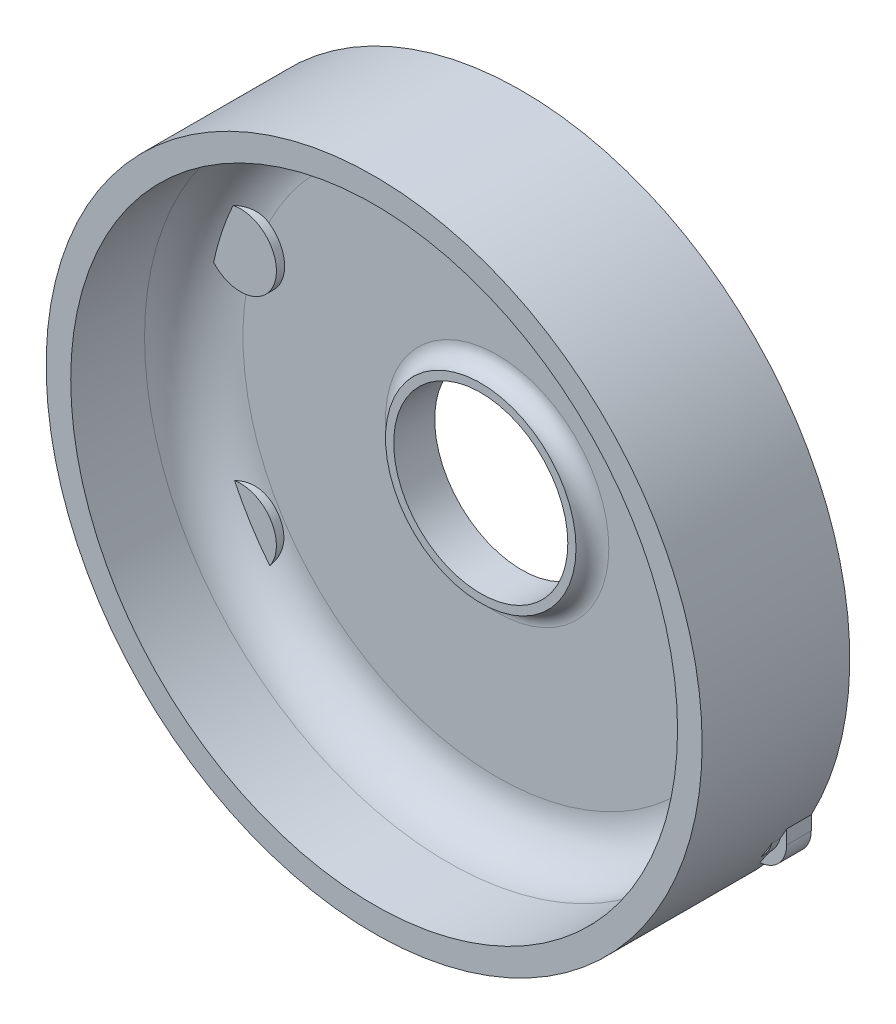
from build123d import *

# Parameters (mm, degrees)
BOSS_EXTRUDE1_OUTLINE_R = 10.616834944
BOSS_EXTRUDE1_DEPTH     = 3
SKETCH3_R               = 40
SKETCH3_R_2             = 37
BOSS_EXTRUDE2_DEPTH     = 15
SKETCH4_R               = 11.616834944
SKETCH4_R_2             = 10.616834944
BOSS_EXTRUDE3_DEPTH     = 2
FILLET2_R               = 2
FILLET3_R               = 6
SKETCH6_R               = 2.38125
CUT_EXTRUDE1_DEPTH      = 3.175
SKETCH8_R               = 4.38125
BOSS_EXTRUDE5_DEPTH     = 1


# Read off the part's stored shape, not the designer's step: Boss-Extrude1
with BuildPart() as part:
    # Boss-Extrude1 outline → Boss-Extrude1 (new body)
    with BuildSketch(Plane.XY):
        with BuildLine():
            Line((-61.158014619, -0.130841154), (-60.258391765, -0.130841154))
            ThreePointArc((-60.258391765, -0.130841154), (-28.255886619, -16.129333036), (3.743709339, -0.125023097))
            ThreePointArc((3.743709339, -0.125023097), (6.087180251, 0.966663669), (7.041985381, 3.369158846))
            Line((7.041985381, 3.369158846), (7.041985381, 5.061001168))
            ThreePointArc((7.041985381, 5.061001168), (-31.332414811, 63.752458818), (-60.262892503, -0.124839588))
            ThreePointArc((-60.262892503, -0.124839588), (-62.604293531, 0.967812618), (-63.558014619, 3.369158846))
            Line((-63.558014619, 3.369158846), (-63.558014619, 2.269158846))
            ThreePointArc((-63.558014619, 2.269158846), (-62.855070894, 0.572102571), (-61.158014619, -0.130841154))
        make_face()
        with Locations((-28.259522786, 23.870666799)):
            Circle(BOSS_EXTRUDE1_OUTLINE_R, mode=Mode.SUBTRACT)
    extrude(amount=BOSS_EXTRUDE1_DEPTH)

    # Sketch3 → Boss-Extrude2 (add)
    with BuildSketch(Plane.XY.offset(3)):
        with Locations(Location((-28.259522786, 23.870666799, 0), (0, 0, 216.861852286))):
            Circle(SKETCH3_R)
        with Locations((-28.259522786, 23.870666799)):
            Circle(SKETCH3_R_2, mode=Mode.SUBTRACT)
    extrude(amount=BOSS_EXTRUDE2_DEPTH)

    # Sketch4 → Boss-Extrude3 (add)
    with BuildSketch(Plane.XY.offset(3)):
        with Locations((-28.259522786, 23.870666799)):
            Circle(SKETCH4_R)
        with Locations((-28.259522786, 23.870666799)):
            Circle(SKETCH4_R_2, mode=Mode.SUBTRACT)
    extrude(amount=BOSS_EXTRUDE3_DEPTH)

    # Fillet2
    fillet2_edges = [part.edges().sort_by_distance(p)[0] for p in [
        (-39.87635773, 23.870666799, 3),
    ]]
    fillet(fillet2_edges, radius=FILLET2_R - 0.0001)  # a hair under: the kernel refuses the full size

    # Fillet3
    fillet3_edges = [part.edges().sort_by_distance(p)[0] for p in [
        (-65.259522786, 23.870666799, 3),
    ]]
    fillet(fillet3_edges, radius=FILLET3_R)

    # Sketch6 → Cut-Extrude1 (cut)
    with BuildSketch(Plane(origin=(0, 0, 0), x_dir=(-1, 0, 0), z_dir=(0, 0, -1))):
        with Locations((58.558014619, 4.869158846)):
            Circle(SKETCH6_R)
        with Locations((58.558014619, 33.869158846)):
            Circle(SKETCH6_R)
        with Locations((-2.041985381, 33.869158846)):
            Circle(SKETCH6_R)
        with Locations((-2.041985381, 4.869158846)):
            Circle(SKETCH6_R)
    extrude(amount=-CUT_EXTRUDE1_DEPTH, mode=Mode.SUBTRACT)

    # Sketch8 → Boss-Extrude5 (add)
    with BuildSketch(Plane(origin=(0, 0, 3), x_dir=(-1, 0, 0), z_dir=(0, 0, -1))):
        with Locations((58.558014619, 4.869158846)):
            Circle(SKETCH8_R)
        with Locations((58.558014619, 33.869158846)):
            Circle(SKETCH8_R)
        with Locations((-2.041985381, 33.869158846)):
            Circle(SKETCH8_R)
        with Locations((-2.041985381, 4.869158846)):
            Circle(SKETCH8_R)
    extrude(amount=-BOSS_EXTRUDE5_DEPTH)


solid = part.part
